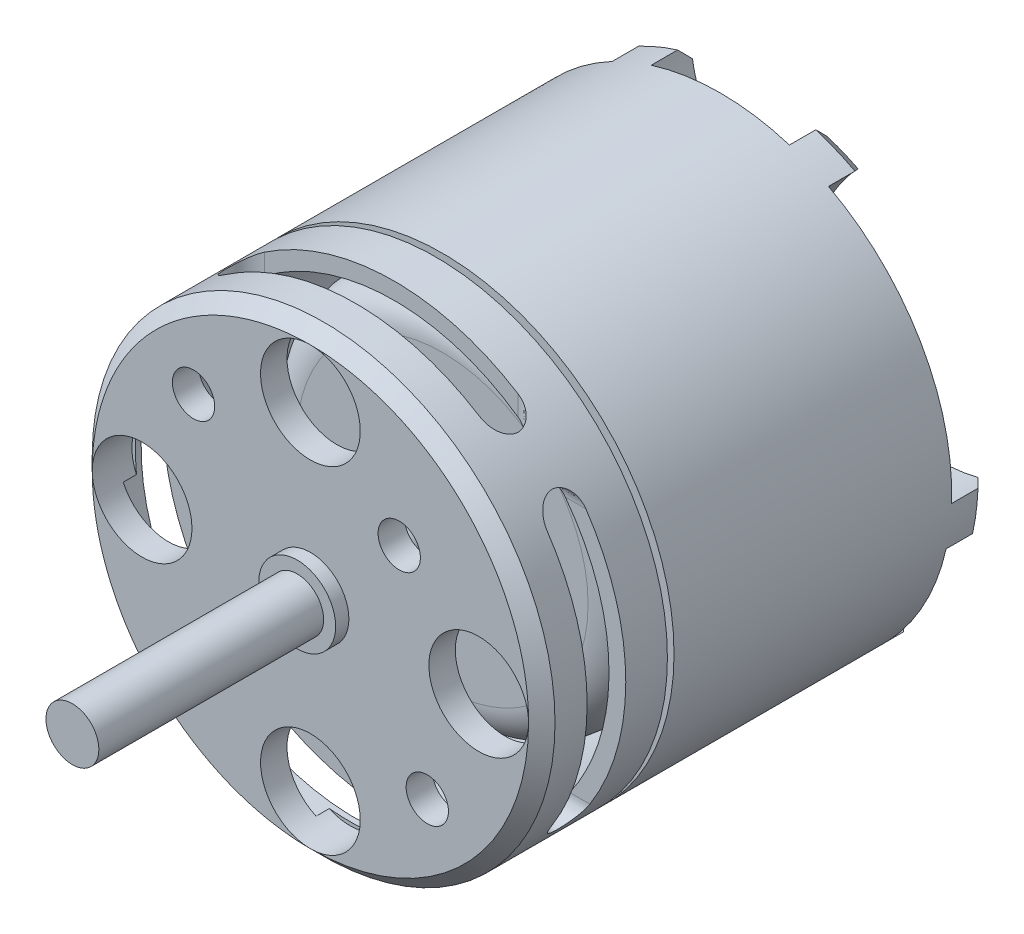
from build123d import *

# Parameters (mm, degrees)
IZIM1_R                     = 5.5
Y_KSEKLIK_EKSTR_ZYON1_DEPTH = 2
IZIM2_R                     = 0.663999635
Y_KSEKLIK_EKSTR_ZYON2_DEPTH = 3
IZIM3_R                     = 17.5
IZIM3_R_2                   = 16.374653702
Y_KSEKLIK_EKSTR_ZYON3_DEPTH = 21
PAH1_SIZE                   = 1
IZIM4_R                     = 3
Y_KSEKLIK_EKSTR_ZYON4_DEPTH = 2
IZIM5_R                     = 14
Y_KSEKLIK_EKSTR_ZYON5_DEPTH = 19
RADYUS1_R                   = 3
IZIM6_R                     = 2
Y_KSEKLIK_EKSTR_ZYON6_DEPTH = 28
Y_KSEKLIK_EKSTR_ZYON7_START = -20
IZIM7_R                     = 17.5
IZIM7_R_2                   = 2
Y_KSEKLIK_EKSTR_ZYON7_DEPTH = 2
PAH2_SIZE                   = 1
Y_KSEKLIK_EKSTR_ZYON8_START = 7.5
IZIM8_R                     = 17.5
IZIM8_R_2                   = 16.23276237
Y_KSEKLIK_EKSTR_ZYON8_DEPTH = 7.5
IZIM9_R                     = 2.909497202
Y_KSEKLIK_EKSTR_ZYON9_DEPTH = 1
KES_EKSTR_ZYON1_START       = 11.671620285
KES_EKSTR_ZYON1_DEPTH       = 5.828379715
DAIRESEL_KAPLAMA1_COUNT     = 4
IZIM11_R                    = 3.770262476
IZIM11_R_2                  = 1.6
KES_EKSTR_ZYON2_DEPTH       = 3


# Read off the part's stored shape, not the designer's step: Kes-Ekstrüzyon1
with BuildPart() as part:
    # Çizim1 → Yükseklik-Ekstrüzyon1 (new body)
    with BuildSketch(Plane.XY):
        Circle(IZIM1_R)
    extrude(amount=Y_KSEKLIK_EKSTR_ZYON1_DEPTH)

    # Çizim2 → Yükseklik-Ekstrüzyon2 (add)
    with BuildSketch(Plane.XY.offset(2)):
        with BuildLine():
            ThreePointArc((8.182540742, 15.469196069), (6.732251982, 16.153228261), (5.225440058, 16.701639925))
            add(Edge.make_bspline(
                [(-5.225440058, 16.701639925), (-4.736720515, 9.76221134), (0, 9.76221134), (4.736720515, 9.76221134), (5.225440058, 16.701639925)],
                knots=[4.815749698, 4.815749698, 4.815749698, 6.283185307, 6.283185307, 7.750620917, 7.750620917, 7.750620917], degree=2, weights=[1, 0.742689967, 1, 0.742689967, 1]))
            ThreePointArc((-5.225440058, 16.701639925), (-6.732251982, 16.153228261), (-8.182540742, 15.469196069))
            add(Edge.make_bspline(
                [(-17.487987142, -0.648309884), (-9.022955268, -3.495829936), (-5.253477685, 3.033096756), (-1.484000102, 9.562023447), (-8.182540742, 15.469196069)],
                knots=[4.948903003, 4.948903003, 4.948903003, 6.283185307, 6.283185307, 7.617467611, 7.617467611, 7.617467611], degree=2, weights=[1, 0.785593765, 1, 0.785593765, 1]))
            ThreePointArc((-17.487987142, -0.648309884), (-17.355232018, -2.246312889), (-17.076764489, -3.825456126))
            add(Edge.make_bspline(
                [(-11.851324431, -12.876183799), (-6.085962761, -8.983225967), (-8.454323018, -4.88110567), (-10.822683275, -0.778985374), (-17.076764489, -3.825456126)],
                knots=[4.815749698, 4.815749698, 4.815749698, 6.283185307, 6.283185307, 7.750620917, 7.750620917, 7.750620917], degree=2, weights=[1, 0.742689967, 1, 0.742689967, 1]))
            ThreePointArc((-11.851324431, -12.876183799), (-10.622980036, -13.906915372), (-9.305446401, -14.820886184))
            add(Edge.make_bspline(
                [(9.305446401, -14.820886184), (7.538955166, -6.066193511), (0, -6.066193511), (-7.538955166, -6.066193511), (-9.305446401, -14.820886184)],
                knots=[1.807310349, 1.807310349, 1.807310349, 3.141592654, 3.141592654, 4.475874958, 4.475874958, 4.475874958], degree=2, weights=[1, 0.785593765, 1, 0.785593765, 1]))
            ThreePointArc((9.305446401, -14.820886184), (10.622980036, -13.906915372), (11.851324431, -12.876183799))
            add(Edge.make_bspline(
                [(17.076764489, -3.825456126), (10.822683275, -0.778985374), (8.454323018, -4.88110567), (6.085962761, -8.983225967), (11.851324431, -12.876183799)],
                knots=[1.674157044, 1.674157044, 1.674157044, 3.141592654, 3.141592654, 4.609028263, 4.609028263, 4.609028263], degree=2, weights=[1, 0.742689967, 1, 0.742689967, 1]))
            ThreePointArc((17.076764489, -3.825456126), (17.355232018, -2.246312889), (17.487987142, -0.648309884))
            add(Edge.make_bspline(
                [(8.182540742, 15.469196069), (1.484000102, 9.562023447), (5.253477685, 3.033096756), (9.022955268, -3.495829936), (17.487987142, -0.648309884)],
                knots=[4.948903003, 4.948903003, 4.948903003, 6.283185307, 6.283185307, 7.617467611, 7.617467611, 7.617467611], degree=2, weights=[1, 0.785593765, 1, 0.785593765, 1]))
        make_face()
        with Locations((0, 7.5)):
            Circle(IZIM2_R, mode=Mode.SUBTRACT)
        with Locations((6.495190528, -3.75)):
            Circle(IZIM2_R, mode=Mode.SUBTRACT)
        with Locations((-6.495190528, -3.75)):
            Circle(IZIM2_R, mode=Mode.SUBTRACT)
    extrude(amount=Y_KSEKLIK_EKSTR_ZYON2_DEPTH)

    # Çizim3 → Yükseklik-Ekstrüzyon3 (add)
    with BuildSketch(Plane.XY.offset(5)):
        with Locations(Location((0, 0, 0), (0, 0, 182.123081258))):
            Circle(IZIM3_R)
        with Locations(Location((0, 0, 0), (0, 0, 183.417890814))):
            Circle(IZIM3_R_2, mode=Mode.SUBTRACT)
    extrude(amount=Y_KSEKLIK_EKSTR_ZYON3_DEPTH)

    # Pah1
    pah1_edges = [part.edges().sort_by_distance(p)[0] for p in [
        (-17.355232018, -2.246312889, 2),
        (-10.622980036, -13.906915372, 2),
        (10.622980036, -13.906915372, 2),
        (17.355232018, -2.246312889, 2),
        (-6.732251982, 16.153228261, 2),
        (6.732251982, 16.153228261, 2),
    ]]
    chamfer(pah1_edges, length=PAH1_SIZE)

    # Çizim4 → Yükseklik-Ekstrüzyon4 (add)
    with BuildSketch(Plane.XY.offset(5)):
        Circle(IZIM4_R)
    extrude(amount=Y_KSEKLIK_EKSTR_ZYON4_DEPTH)

    # Çizim5 → Yükseklik-Ekstrüzyon5 (add)
    with BuildSketch(Plane.XY.offset(7)):
        Circle(IZIM5_R)
    extrude(amount=Y_KSEKLIK_EKSTR_ZYON5_DEPTH)

    # Radyus1
    radyus1_edges = [part.edges().sort_by_distance(p)[0] for p in [
        (-14, 0, 7),
        (-14, 0, 26),
    ]]
    fillet(radyus1_edges, radius=RADYUS1_R)

    # Çizim6 → Yükseklik-Ekstrüzyon6 (add)
    with BuildSketch(Plane.XY.offset(26)):
        Circle(IZIM6_R)
    extrude(amount=Y_KSEKLIK_EKSTR_ZYON6_DEPTH)

    # Çizim7 → Yükseklik-Ekstrüzyon7 (add)
    with BuildSketch(Plane.XY.offset(54).offset(Y_KSEKLIK_EKSTR_ZYON7_START)):
        with Locations(Location((0, 0, 0), (0, 0, 182.123081258))):
            Circle(IZIM7_R)
        Circle(IZIM7_R_2, mode=Mode.SUBTRACT)
    extrude(amount=Y_KSEKLIK_EKSTR_ZYON7_DEPTH)

    # Pah2
    pah2_edges = [part.edges().sort_by_distance(p)[0] for p in [
        (17.487987142, 0.648309885, 36),
    ]]
    chamfer(pah2_edges, length=PAH2_SIZE)

    # Çizim8 → Yükseklik-Ekstrüzyon8 (add)
    with BuildSketch(Plane(origin=(0, 0, 34), x_dir=(-1, 0, 0), z_dir=(0, 0, -1)).offset(Y_KSEKLIK_EKSTR_ZYON8_START)):
        with Locations(Location((0, 0, 0), (0, 0, 357.876918742))):
            Circle(IZIM8_R)
        Circle(IZIM8_R_2, mode=Mode.SUBTRACT)
    extrude(amount=-Y_KSEKLIK_EKSTR_ZYON8_DEPTH)

    # Çizim9 → Yükseklik-Ekstrüzyon9 (add)
    with BuildSketch(Plane.XY.offset(36)):
        Circle(IZIM9_R)
    extrude(amount=Y_KSEKLIK_EKSTR_ZYON9_DEPTH)

    # Kes-Ekstrüzyon1 outline → Kes-Ekstrüzyon1 (cut)
    with BuildSketch(Plane(origin=(0, 0, 0), x_dir=(1, 0, 0), z_dir=(0, 1, 0)).offset(KES_EKSTR_ZYON1_START)):
        with BuildLine():
            add(Edge.make_bspline(
                [(9.363321799, -29.649134948), (9.72520204, -29.649134948), (10.071370268, -29.779077714), (10.621814979, -30.279572975), (10.823246274, -30.681241505), (10.826558395, -31.528788386), (10.628202094, -31.933158026), (10.077276862, -32.439855571), (9.725775922, -32.572318339), (9.363321799, -32.572318339)],
                knots=[0, 0, 0, 0, 0.25, 0.25, 0.5, 0.5, 0.75, 0.75, 1, 1, 1, 1], degree=3))
            Line((9.363321799, -29.649134948), (-9.820069204, -29.649134948))
            add(Edge.make_bspline(
                [(-9.820069204, -32.572318339), (-10.179428491, -32.572318339), (-10.523143269, -32.444596504), (-11.073662171, -31.94859693), (-11.280199441, -31.545308126), (-11.283105639, -30.686031737), (-11.078521192, -30.279762038), (-10.529133724, -29.779775448), (-10.179873392, -29.649134948), (-9.820069204, -29.649134948)],
                knots=[0, 0, 0, 0, 0.25, 0.25, 0.5, 0.5, 0.75, 0.75, 1, 1, 1, 1], degree=3))
            Line((-9.820069204, -32.572318339), (9.363321799, -32.572318339))
        make_face()
    kes_ekstr_zyon1 = extrude(amount=KES_EKSTR_ZYON1_DEPTH, mode=Mode.SUBTRACT)

    # Dairesel Kaplama1: Kes-Ekstrüzyon1 ×4 about axis
    dairesel_kaplama1_axis = Axis((0, 0, 0), (0, 0, -1))
    for i in range(1, DAIRESEL_KAPLAMA1_COUNT):
        add(kes_ekstr_zyon1.rotate(dairesel_kaplama1_axis, i * 360 / DAIRESEL_KAPLAMA1_COUNT), mode=Mode.SUBTRACT)

    # Çizim11 → Kes-Ekstrüzyon2 (cut)
    with BuildSketch(Plane.XY.offset(36)):
        with Locations(Location((0, 12.729737524, 0), (0, 0, 65.349719476))):
            Circle(IZIM11_R)
        with Locations(Location((12.729737524, 0, 0), (0, 0, 0.000475192))):
            Circle(IZIM11_R)
        with Locations(Location((0, -12.729737524, 0), (0, 0, 294.650280524))):
            Circle(IZIM11_R)
        with Locations(Location((-12.729737524, 0, 0), (0, 0, 204.650280524))):
            Circle(IZIM11_R)
        with Locations((-8.838834765, 8.838834765)):
            Circle(IZIM11_R_2)
        with Locations((8.838834765, -8.838834765)):
            Circle(IZIM11_R_2)
        with Locations((-6.717514421, -6.717514421)):
            Circle(IZIM11_R_2)
        with Locations((6.717514421, 6.717514421)):
            Circle(IZIM11_R_2)
    extrude(amount=-KES_EKSTR_ZYON2_DEPTH, mode=Mode.SUBTRACT)


solid = part.part
